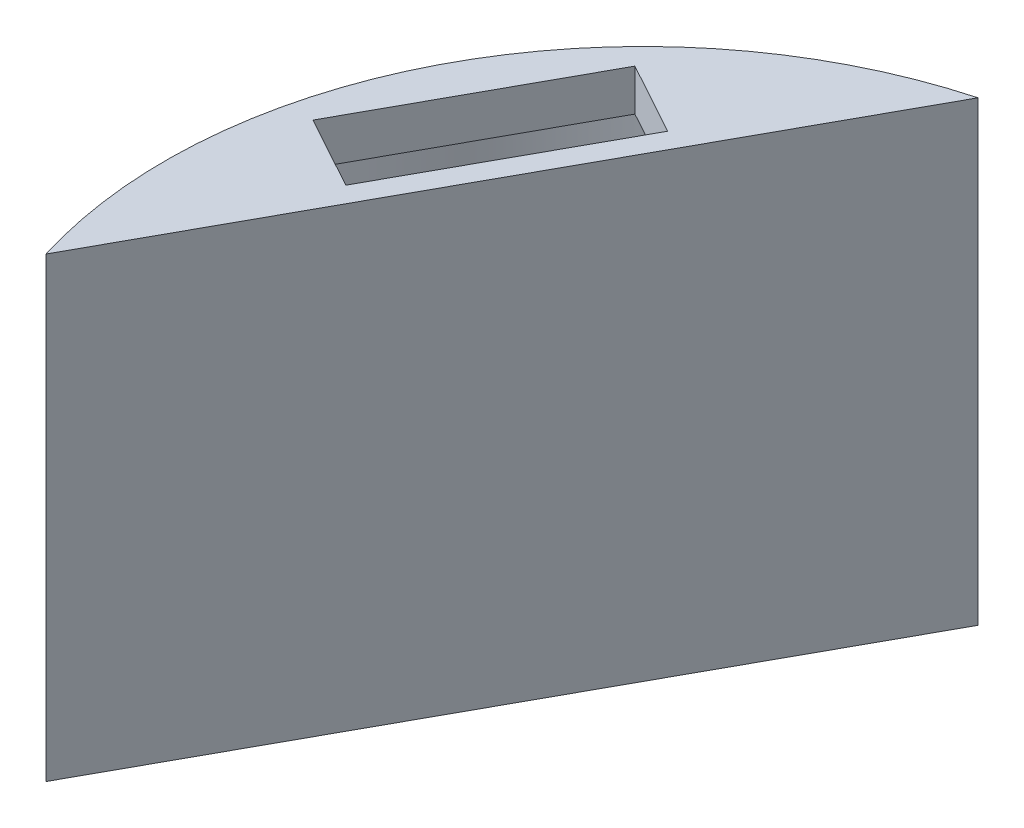
from build123d import *

# Parameters (mm, degrees)
SKETCH1_R           = 73.025
SKETCH1_R_2         = 69.85
BOSS_EXTRUDE1_DEPTH = 63.5
BOSS_EXTRUDE2_START = 6.35
SKETCH2_R           = 73.025
BOSS_EXTRUDE2_DEPTH = 6.35
BOSS_EXTRUDE3_DEPTH = 63.5
CUT_EXTRUDE2_START  = -63.5
CUT_EXTRUDE2_DEPTH  = 57.15
CUT_EXTRUDE5_DEPTH  = 1016
CUT_EXTRUDE6_DEPTH  = 6.35


with BuildPart() as part:
    # Sketch1 → Boss-Extrude1 (new body)
    with BuildSketch(Plane(origin=(0, 0, 0), x_dir=(1, 0, 0), z_dir=(0, 1, 0))):
        Circle(SKETCH1_R)
        Circle(SKETCH1_R_2, mode=Mode.SUBTRACT)
    extrude(amount=BOSS_EXTRUDE1_DEPTH)

    # Sketch2 → Boss-Extrude2 (add)
    with BuildSketch(Plane.XZ.offset(BOSS_EXTRUDE2_START)):
        Circle(SKETCH2_R)
    extrude(amount=-BOSS_EXTRUDE2_DEPTH)

    # Sketch3 → Boss-Extrude3 (add)
    with BuildSketch(Plane(origin=(0, 0, 0), x_dir=(1, 0, 0), z_dir=(0, 1, 0))):
        with BuildLine():
            Line((-67.615293174, -17.526968618), (-21.409243237, 66.488095205))
            ThreePointArc((-21.409243237, 66.488095205), (-61.204368783, 33.660774529), (-67.615293174, -17.526968618))
        make_face()
    extrude(amount=BOSS_EXTRUDE3_DEPTH)

    # Sketch4 → Cut-Extrude2 (cut)
    with BuildSketch(Plane(origin=(0, 63.5, 0), x_dir=(1, 0, 0), z_dir=(0, 1, 0)).offset(CUT_EXTRUDE2_START)):
        with BuildLine():
            Line((-25.79189716, 64.913793148), (-68.632882923, -12.982676212))
            ThreePointArc((-68.632882923, -12.982676212), (-61.204368783, 33.660774529), (-25.79189716, 64.913793148))
        make_face()
    extrude(amount=CUT_EXTRUDE2_DEPTH, mode=Mode.SUBTRACT)

    # Sketch7 → Cut-Extrude5 (cut)
    with BuildSketch(Plane(origin=(0, 63.5, 0), x_dir=(1, 0, 0), z_dir=(0, 1, 0))):
        Polygon((-72.609628953, -26.608018388), (-10.171407592, 86.921512047), (114.959945388, 65.80584256), (122.548753565, -33.748740716), (41.017949176, -93.980716613), (-75.603403444, -72.676842996), align=None)
    extrude(amount=-CUT_EXTRUDE5_DEPTH, mode=Mode.SUBTRACT)

    # Sketch8 → Cut-Extrude6 (cut)
    with BuildSketch(Plane(origin=(0, 63.5, 0), x_dir=(1, 0, 0), z_dir=(0, 1, 0))):
        Polygon((-38.526602298, 42.292375377), (-55.98825761, 10.542375377), (-67.116324662, 16.6625162), (-49.654669349, 48.4125162), align=None)
    extrude(amount=-CUT_EXTRUDE6_DEPTH, mode=Mode.SUBTRACT)


solid = part.part
